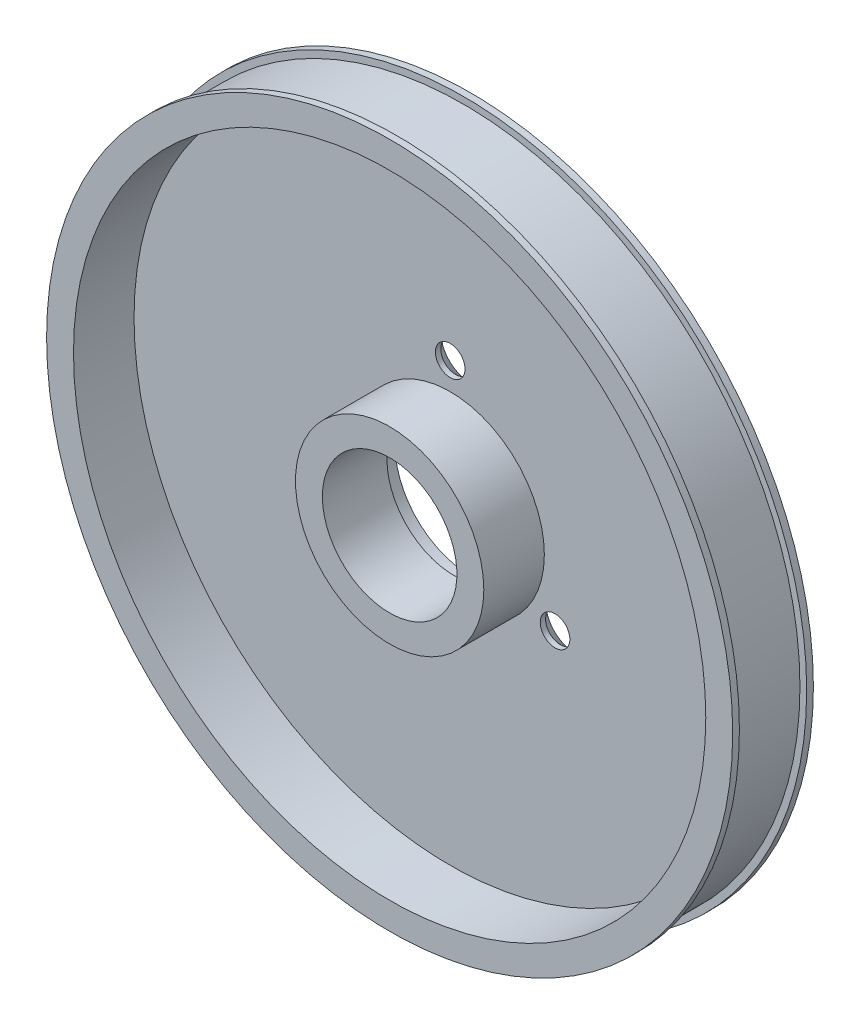
from build123d import *

# Parameters (mm, degrees)
M42_CLEARANCE_HOLE1_D                           = 47
M42_CLEARANCE_HOLE1_DEPTH                       = 4.5
SKETCH4_W                                       = 7
SKETCH4_H                                       = 4.5
CSK_FOR_M2_FLAT_HEAD_MACHINE_SCREW1_D           = 2.2
CSK_FOR_M2_FLAT_HEAD_MACHINE_SCREW1_DEPTH       = 6
CSK_FOR_M2_FLAT_HEAD_MACHINE_SCREW1_CSINK_D     = 4.4
CSK_FOR_M2_FLAT_HEAD_MACHINE_SCREW1_CSINK_ANGLE = 90
CBORE_FOR_M8_HEX_HEAD_BOLT1_D                   = 10
CBORE_FOR_M8_HEX_HEAD_BOLT1_CBORE_D             = 11.2
CBORE_FOR_M8_HEX_HEAD_BOLT1_CBORE_DEPTH         = 1.2


with BuildPart() as part:
    # Sketch1 → Revolve1 (revolve)
    with BuildSketch(Plane(origin=(0, 0, 0), x_dir=(1, 0, 0), z_dir=(0, 1, 0))):
        Polygon((25.5, 0), (0, 0), (0, -6), (25.5, -6), (25.5, -5.5), (25, -5.5), (25, -0.5), (25.5, -0.5), align=None)
    revolve(axis=Axis((0, 0, 0), (0, 0, 1)))

    # M42 Clearance Hole1
    with Locations(Plane.XY.offset(6)):
        with Locations((0, 0)):
            Hole(M42_CLEARANCE_HOLE1_D / 2, depth=M42_CLEARANCE_HOLE1_DEPTH)

    # Sketch4 → Revolve2 (revolve)
    with BuildSketch(Plane(origin=(0, 0, 0), x_dir=(1, 0, 0), z_dir=(0, 1, 0))):
        with Locations((3.5, -3.75)):
            Rectangle(SKETCH4_W, SKETCH4_H)
    revolve(axis=Axis((0, 0, 1.5), (0, 0, 1)))

    # CSK for M2 Flat Head Machine Screw1
    with Locations(Plane(origin=(0, 0, 0), x_dir=(-1, 0, 0), z_dir=(0, 0, -1))):
        with Locations((-7.794228634, -4.5), (7.794228634, -4.5), (0, 9)):
            CounterSinkHole(CSK_FOR_M2_FLAT_HEAD_MACHINE_SCREW1_D / 2, CSK_FOR_M2_FLAT_HEAD_MACHINE_SCREW1_CSINK_D / 2, depth=CSK_FOR_M2_FLAT_HEAD_MACHINE_SCREW1_DEPTH, counter_sink_angle=CSK_FOR_M2_FLAT_HEAD_MACHINE_SCREW1_CSINK_ANGLE)

    # CBORE for M8 Hex Head Bolt1 (through all)
    with Locations(Plane(origin=(0, 0, 0), x_dir=(-1, 0, 0), z_dir=(0, 0, -1))):
        with Locations((0, 0)):
            CounterBoreHole(CBORE_FOR_M8_HEX_HEAD_BOLT1_D / 2, CBORE_FOR_M8_HEX_HEAD_BOLT1_CBORE_D / 2, CBORE_FOR_M8_HEX_HEAD_BOLT1_CBORE_DEPTH)


solid = part.part
